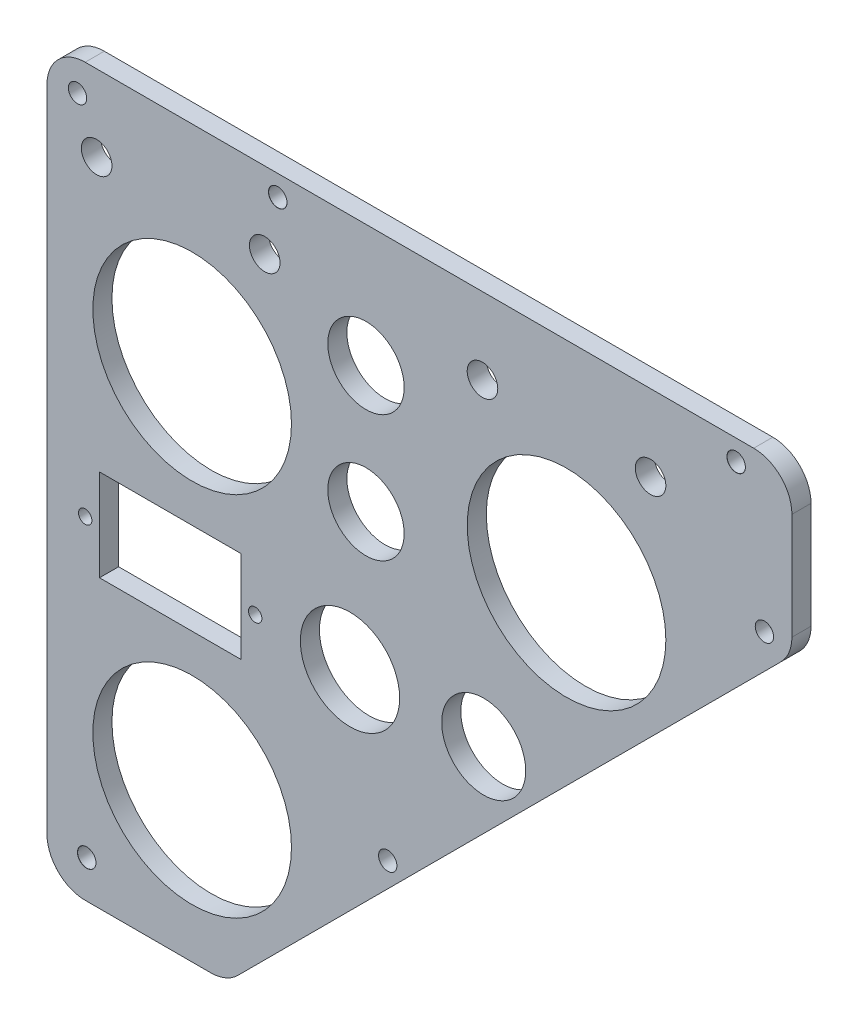
from build123d import *

# Parameters (mm, degrees)
ESTRUSIONE_ESTRUSIONE1_DEPTH   = 5
FORO_PER_VITE_M4_2_D           = 4.8
FORO_PER_VITE_M4_2_CSINK_D     = 4.85
FORO_PER_VITE_M4_2_CSINK_ANGLE = 90
SCHIZZO5_R                     = 1.75
SCHIZZO5_R_2                   = 10
SCHIZZO5_R_3                   = 11
SCHIZZO5_R_4                   = 13
SCHIZZO5_R_5                   = 26
SCHIZZO5_W                     = 37
SCHIZZO5_H                     = 24
TAGLIO_ESTRUSIONE2_DEPTH       = 7
SCHIZZO6_R                     = 4
TAGLIO_ESTRUSIONE3_DEPTH       = 10
FORO_PER_VITE_M4_1_D           = 4.8
FORO_PER_VITE_M4_1_DEPTH       = 40.6
FORO_PER_VITE_M4_1_CSINK_D     = 8.05
FORO_PER_VITE_M4_1_CSINK_ANGLE = 90
FORO_PER_VITE_M4_1_TIP         = 1.442065486


with BuildPart() as part:
    # Schizzo1 → Estrusione-Estrusione1 (new body)
    with BuildSketch(Plane.XY):
        with BuildLine():
            Line((0, 10), (0, 180))
            ThreePointArc((0, 180), (2.928932188, 187.071067812), (10, 190))
            Line((10, 190), (185, 190))
            ThreePointArc((185, 190), (192.071067812, 187.071067812), (195, 180))
            Line((195, 180), (195, 152.142135624))
            ThreePointArc((195, 152.142135624), (194.238795325, 148.3153013), (192.071067812, 145.071067812))
            Line((192.071067812, 145.071067812), (49.928932188, 2.928932188))
            ThreePointArc((49.928932188, 2.928932188), (46.6846987, 0.761204675), (42.857864376, 0))
            Line((42.857864376, 0), (10, 0))
            ThreePointArc((10, 0), (2.928932188, 2.928932188), (0, 10))
        make_face()
    extrude(amount=ESTRUSIONE_ESTRUSIONE1_DEPTH)

    # Foro per Vite M4-2 (through all)
    with Locations(Plane.XY.offset(5)):
        with Locations((60.4, 184.6), (10.4, 9.89), (180.4, 184.6)):
            CounterSinkHole(FORO_PER_VITE_M4_2_D / 2, FORO_PER_VITE_M4_2_CSINK_D / 2, counter_sink_angle=FORO_PER_VITE_M4_2_CSINK_ANGLE)

    # Schizzo5 → Taglio-Estrusione2 (cut)
    with BuildSketch(Plane.XY.offset(5)):
        with Locations((10, 87)):
            Circle(SCHIZZO5_R)
        with Locations((54.5, 87)):
            Circle(SCHIZZO5_R)
        with Locations((83.5, 158)):
            Circle(SCHIZZO5_R_2)
        with Locations((114.319509986, 87)):
            Circle(SCHIZZO5_R_3)
        with Locations((79.319509986, 87)):
            Circle(SCHIZZO5_R_4)
        with Locations((38, 135)):
            Circle(SCHIZZO5_R_5)
        with Locations((136, 135)):
            Circle(SCHIZZO5_R_5)
        with Locations((38, 39)):
            Circle(SCHIZZO5_R_5)
        with Locations((83.5, 124.850051573)):
            Circle(SCHIZZO5_R_2)
        with Locations((32.25, 87)):
            Rectangle(SCHIZZO5_W, SCHIZZO5_H)
    extrude(amount=-TAGLIO_ESTRUSIONE2_DEPTH, mode=Mode.SUBTRACT)

    # Schizzo6 → Taglio-Estrusione3 (cut)
    with BuildSketch(Plane.XY.offset(5)):
        with Locations((13, 170)):
            Circle(SCHIZZO6_R)
        with Locations((57, 170)):
            Circle(SCHIZZO6_R)
        with Locations((114, 170)):
            Circle(SCHIZZO6_R)
        with Locations((158, 170)):
            Circle(SCHIZZO6_R)
    extrude(amount=-TAGLIO_ESTRUSIONE3_DEPTH, mode=Mode.SUBTRACT)

    # Foro per Vite M4-1
    with Locations(Plane(origin=(0, 0, 0), x_dir=(-1, 0, 0), z_dir=(0, 0, -1))):
        with Locations((-187.8, 149.819090886), (-8, 182), (-89.193929867, 48.6)):
            CounterSinkHole(FORO_PER_VITE_M4_1_D / 2, FORO_PER_VITE_M4_1_CSINK_D / 2, depth=FORO_PER_VITE_M4_1_DEPTH, counter_sink_angle=FORO_PER_VITE_M4_1_CSINK_ANGLE)
            with Locations((0, 0, -(FORO_PER_VITE_M4_1_DEPTH + FORO_PER_VITE_M4_1_TIP / 2))):  # 118° drill point
                Cone(0, FORO_PER_VITE_M4_1_D / 2, FORO_PER_VITE_M4_1_TIP, mode=Mode.SUBTRACT)


solid = part.part
